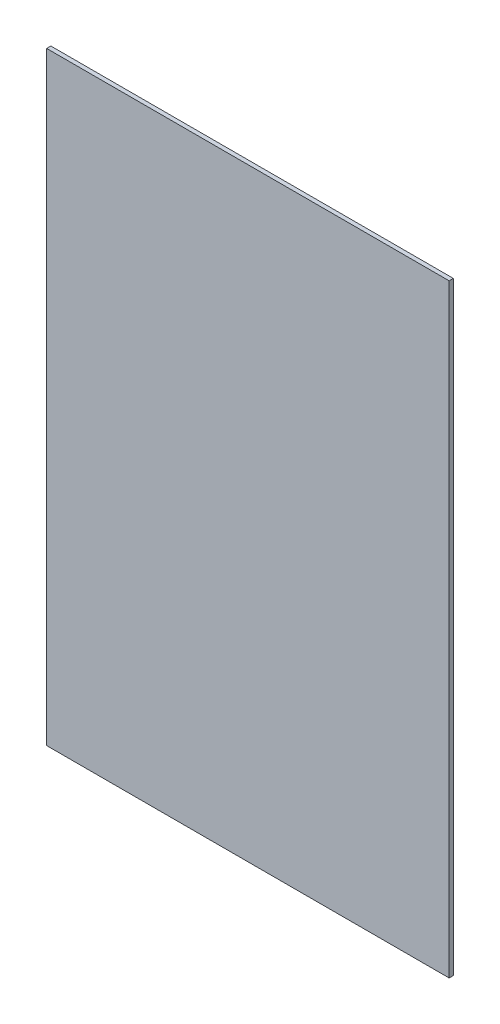
from build123d import *

# Parameters (mm, degrees)
SKETCH1_W           = 609.6
SKETCH1_H           = 914.4
BOSS_EXTRUDE1_DEPTH = 3.175


with BuildPart() as part:
    # Sketch1 → Boss-Extrude1 (new, symmetric)
    with BuildSketch(Plane.XY):
        Rectangle(SKETCH1_W, SKETCH1_H)
    extrude(amount=BOSS_EXTRUDE1_DEPTH, both=True)


solid = part.part
